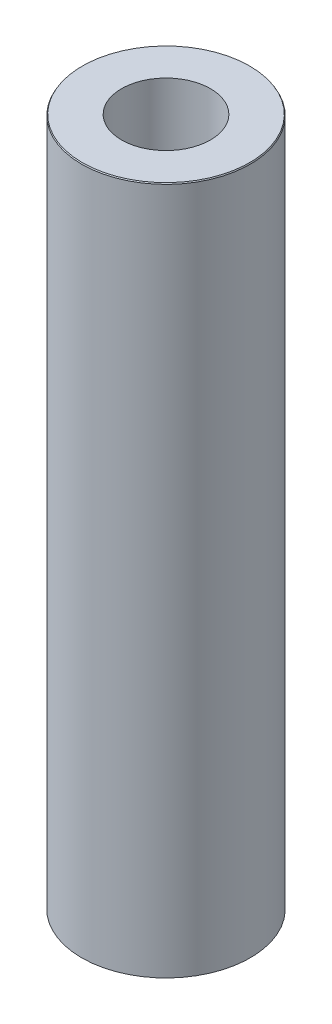
from build123d import *
from OCP.BRepFilletAPI import BRepFilletAPI_MakeChamfer

# Parameters (mm, degrees)
SKETCH1_R           = 40
BOSS_EXTRUDE1_DEPTH = 326.847605287
SKETCH2_R           = 21.094543599
CUT_EXTRUDE1_DEPTH  = 332.70673355
CHAMFER1_SIZE       = 0.516873523
CHAMFER1_SIZE2      = 0.298417068


with BuildPart() as part:
    # Sketch1 → Boss-Extrude1 (new body)
    with BuildSketch(Plane(origin=(0, 0, 0), x_dir=(1, 0, 0), z_dir=(0, 1, 0))):
        Circle(SKETCH1_R)
    extrude(amount=BOSS_EXTRUDE1_DEPTH)

    # Sketch2 → Cut-Extrude1 (cut, through all)
    with BuildSketch(Plane(origin=(0, 0, 0), x_dir=(1, 0, 0), z_dir=(0, 1, 0))):
        Circle(SKETCH2_R)
    extrude(amount=CUT_EXTRUDE1_DEPTH, mode=Mode.SUBTRACT)

    # Chamfer1: one chamfer whose edges measure the first distance from different faces: ONE call of the kernel's chamfer builder (chamfer() names one face for all edges)
    chamfer1_edges_1 = [part.edges().sort_by_distance(p)[0] for p in [
        (-40, 326.847605287, 0),
    ]]
    chamfer1_side_1 = [part.faces().sort_by_distance(p)[0] for p in [
        (-40, 163.423802644, 0),
    ]]
    chamfer1_edges_2 = [part.edges().sort_by_distance(p)[0] for p in [
        (-40, 0, 0),
    ]]
    chamfer1_side_2 = [part.faces().sort_by_distance(p)[0] for p in [
        (-38.86862915, 0, 0),
    ]]
    chamfer1 = BRepFilletAPI_MakeChamfer(part.part.solid().wrapped)
    for e in chamfer1_edges_1:
        chamfer1.Add(CHAMFER1_SIZE, CHAMFER1_SIZE2, e.wrapped, chamfer1_side_1[0].wrapped)  # the first distance lies on this face
    for e in chamfer1_edges_2:
        chamfer1.Add(CHAMFER1_SIZE, CHAMFER1_SIZE2, e.wrapped, chamfer1_side_2[0].wrapped)  # the first distance lies on this face
    add(Compound.cast(chamfer1.Shape()), mode=Mode.REPLACE)


solid = part.part
